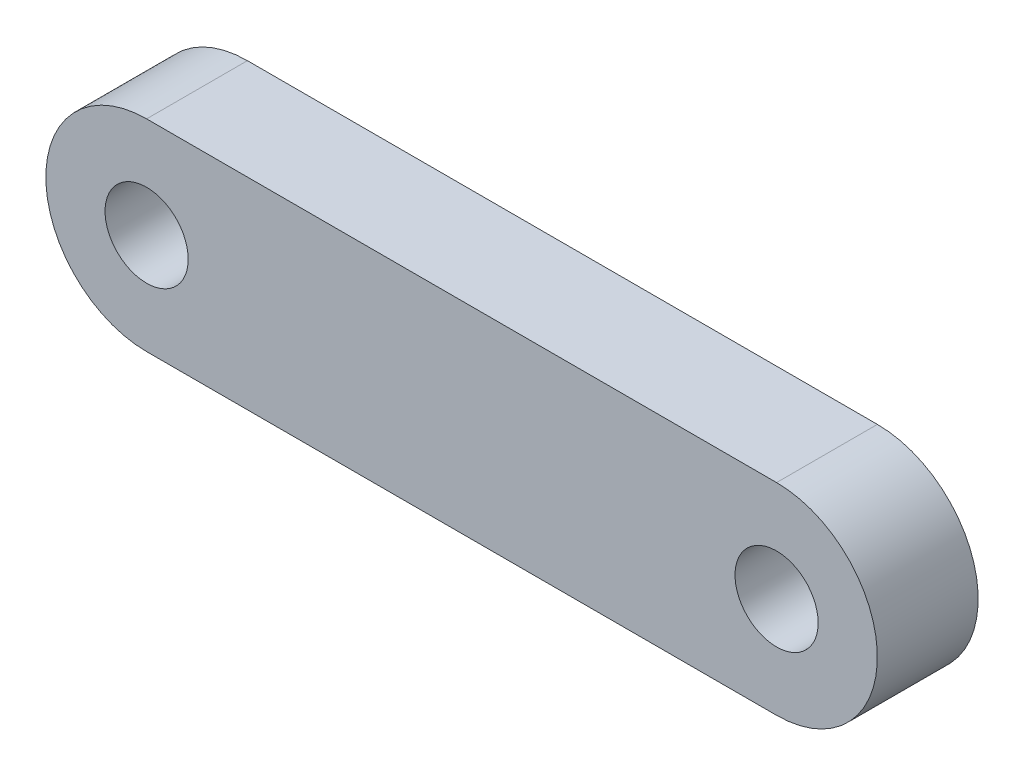
from build123d import *

# Parameters (mm, degrees)
SKETCH1_R           = 1.65
BOSS_EXTRUDE1_DEPTH = 4


with BuildPart() as part:
    # Sketch1 → Boss-Extrude1 (new body)
    with BuildSketch(Plane.XY):
        with BuildLine():
            Line((-25, 4), (0, 4))
            ThreePointArc((0, 4), (4, 0), (0, -4))
            Line((0, -4), (-25, -4))
            ThreePointArc((-25, -4), (-29, 0), (-25, 4))
        make_face()
        Circle(SKETCH1_R, mode=Mode.SUBTRACT)
        with Locations((-25, 0)):
            Circle(SKETCH1_R, mode=Mode.SUBTRACT)
    extrude(amount=BOSS_EXTRUDE1_DEPTH)


solid = part.part
